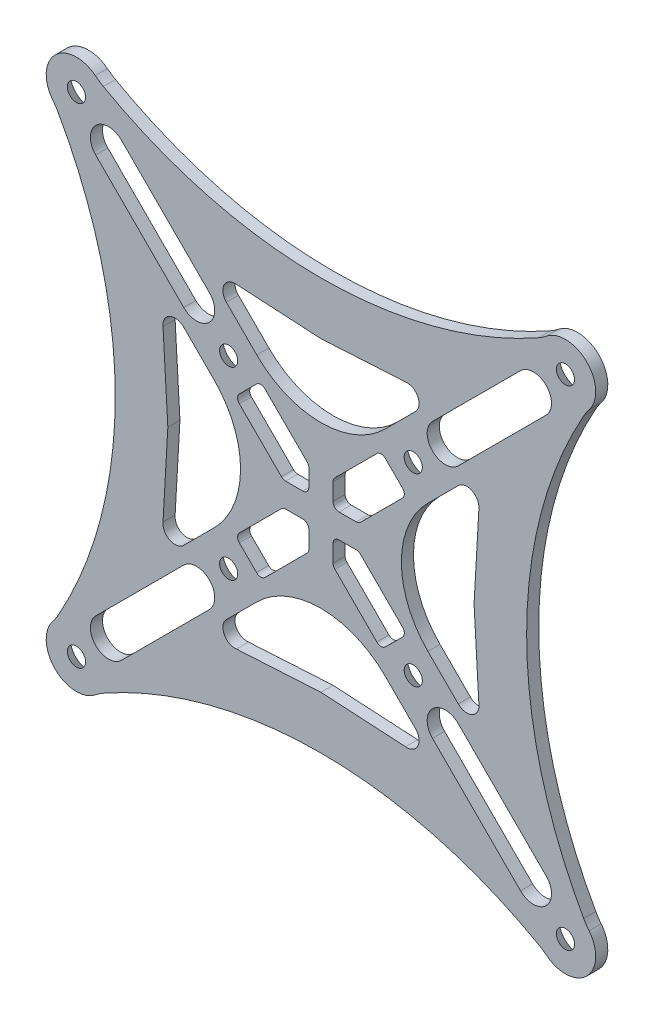
from build123d import *
from OCP.BRepFilletAPI import BRepFilletAPI_MakeChamfer

# Parameters (mm, degrees)
SKETCH_1_R       = 1.5
EXTRUDE_1_DEPTH  = 2
CHAMFER_2_SIZE   = 2
CHAMFER_2_SIZE_2 = 1.5


with BuildPart() as part:
    # 草图1 → 凸台-拉伸1 (new body)
    with BuildSketch(Plane.XY):
        with BuildLine():
            ThreePointArc((-43.944231971, -35.993777794), (-44.364829153, -36.675490513), (-44.838639776, -37.321352508))
            ThreePointArc((-44.838639776, -37.321352508), (-44.464367688, -43.973521466), (-37.812198776, -44.347794369))
            ThreePointArc((-37.812198776, -44.347794369), (-37.166337282, -43.873984202), (-36.484625127, -43.453387388))
            ThreePointArc((-36.484625127, -43.453387388), (-0.528600442, -34.027870838), (35.427423346, -43.453390808))
            ThreePointArc((35.427423346, -43.453390808), (36.109133758, -43.873986539), (36.754993697, -44.347795354))
            ThreePointArc((36.754993697, -44.347795354), (43.407161932, -43.973520907), (43.78143346, -37.321352507))
            ThreePointArc((43.78143346, -37.321352507), (43.307622836, -36.675490511), (42.887025653, -35.99377779))
            ThreePointArc((42.887025653, -35.99377779), (33.461509541, -0.037757365), (42.887025658, 35.918263059))
            ThreePointArc((42.887025658, 35.918263059), (43.307622839, 36.599975778), (43.781433461, 37.245837772))
            ThreePointArc((43.781433461, 37.245837772), (43.407160939, 43.898007163), (36.754991502, 44.272278867))
            ThreePointArc((36.754991502, 44.272278867), (36.109129005, 43.798467788), (35.42741572, 43.377870236))
            ThreePointArc((35.42741572, 43.377870236), (-0.528600445, 33.952354559), (-36.484617506, 43.37786682))
            ThreePointArc((-36.484617506, 43.37786682), (-37.166332534, 43.798465454), (-37.812196583, 44.272277884))
            ThreePointArc((-37.812196583, 44.272277884), (-44.464366696, 43.898007721), (-44.838639776, 37.245837771))
            ThreePointArc((-44.838639776, 37.245837771), (-44.364829153, 36.599975777), (-43.944231971, 35.918263057))
            ThreePointArc((-43.944231971, 35.918263057), (-34.518715856, -0.037757368), (-43.944231971, -35.993777794))
        make_face()
        with Locations((-40.928833565, 40.36247304)):
            Circle(SKETCH_1_R, mode=Mode.SUBTRACT)
        with BuildLine():
            Line((-37.74685305, -33.013366574), (-23.20322436, -18.469737884))
            ThreePointArc((-23.20322436, -18.469737884), (-18.960583673, -18.469737884), (-18.960583673, -22.712378571))
            Line((-18.960583673, -22.712378571), (-33.504212363, -37.256007261))
            ThreePointArc((-33.504212363, -37.256007261), (-37.74685305, -37.256007261), (-37.74685305, -33.013366574))
        make_face(mode=Mode.SUBTRACT)
        with BuildLine():
            Line((10.07799856, -17.715426898), (15.096806284, -22.734234622))
            ThreePointArc((15.096806284, -22.734234622), (15.4831952, -25.018982914), (13.452558365, -26.13517519))
            add(Edge.make_bspline(
                [(13.452558365, -26.13517519), (8.792171191, -25.869430733), (4.131784017, -25.603686276), (-0.528603157, -25.33794182)],
                knots=[0, 0, 0, 0, 1.400387298, 1.400387298, 1.400387298, 1.400387298], degree=3))
            add(Edge.make_bspline(
                [(-14.50976468, -26.13517519), (-9.849377505, -25.869430733), (-5.188990331, -25.603686276), (-0.528603157, -25.33794182)],
                knots=[0, 0, 0, 0, 1.400387298, 1.400387298, 1.400387298, 1.400387298], degree=3))
            ThreePointArc((-14.50976468, -26.13517519), (-16.540401515, -25.018982914), (-16.154012599, -22.734234622))
            Line((-16.154012599, -22.734234622), (-11.135204875, -17.715426898))
            ThreePointArc((-11.135204875, -17.715426898), (-0.528603157, -13.322028616), (10.07799856, -17.715426898))
        make_face(mode=Mode.SUBTRACT)
        with BuildLine():
            Line((-18.206272687, -10.644359086), (-23.225080411, -15.66316681))
            ThreePointArc((-23.225080411, -15.66316681), (-25.509828703, -16.049555726), (-26.626020979, -14.01891889))
            add(Edge.make_bspline(
                [(-26.626020979, -14.01891889), (-26.360276522, -9.358531716), (-26.094532065, -4.698144542), (-25.828787609, -0.037757368)],
                knots=[0, 0, 0, 0, 1.400387298, 1.400387298, 1.400387298, 1.400387298], degree=3))
            add(Edge.make_bspline(
                [(-26.626020979, 13.943404154), (-26.360276522, 9.28301698), (-26.094532065, 4.622629806), (-25.828787609, -0.037757368)],
                knots=[0, 0, 0, 0, 1.400387298, 1.400387298, 1.400387298, 1.400387298], degree=3))
            ThreePointArc((-26.626020979, 13.943404154), (-25.509828703, 15.974040989), (-23.225080411, 15.587652073))
            Line((-23.225080411, 15.587652073), (-18.206272687, 10.568844349))
            ThreePointArc((-18.206272687, 10.568844349), (-13.812874405, -0.037757368), (-18.206272687, -10.644359086))
        make_face(mode=Mode.SUBTRACT)
        with BuildLine():
            ThreePointArc((-9.768195517, -13.519990415), (-10.475302299, -13.812883634), (-11.18240908, -13.519990415))
            Line((-11.18240908, -13.519990415), (-14.010836204, -10.691563291))
            ThreePointArc((-14.010836204, -10.691563291), (-14.303729423, -9.984456509), (-14.010836204, -9.277349728))
            Line((-14.010836204, -9.277349728), (-7.064137063, -2.330650587))
            ThreePointArc((-7.064137063, -2.330650587), (-6.739713715, -2.113877836), (-6.357030282, -2.037757368))
            Line((-6.357030282, -2.037757368), (-3.528603157, -2.037757368))
            ThreePointArc((-3.528603157, -2.037757368), (-2.821496376, -2.330650587), (-2.528603157, -3.037757368))
            Line((-2.528603157, -3.037757368), (-2.528603157, -5.866184493))
            ThreePointArc((-2.528603157, -5.866184493), (-2.604723625, -6.248867925), (-2.821496376, -6.573291274))
            Line((-2.821496376, -6.573291274), (-9.768195517, -13.519990415))
        make_face(mode=Mode.SUBTRACT)
        with BuildLine():
            ThreePointArc((17.903377358, -22.712378571), (17.903377358, -18.469737884), (22.146018045, -18.469737884))
            Line((22.146018045, -18.469737884), (36.689646735, -33.013366574))
            ThreePointArc((36.689646735, -33.013366574), (36.689646735, -37.256007261), (32.447006048, -37.256007261))
            Line((32.447006048, -37.256007261), (17.903377358, -22.712378571))
        make_face(mode=Mode.SUBTRACT)
        with BuildLine():
            ThreePointArc((12.95362989, -9.277349728), (13.246523108, -9.984456509), (12.95362989, -10.691563291))
            Line((12.95362989, -10.691563291), (10.125202765, -13.519990415))
            ThreePointArc((10.125202765, -13.519990415), (9.418095984, -13.812883634), (8.710989202, -13.519990415))
            Line((8.710989202, -13.519990415), (1.764290061, -6.573291274))
            ThreePointArc((1.764290061, -6.573291274), (1.54751731, -6.248867925), (1.471396843, -5.866184493))
            Line((1.471396843, -5.866184493), (1.471396843, -3.037757368))
            ThreePointArc((1.471396843, -3.037757368), (1.764290061, -2.330650587), (2.471396843, -2.037757368))
            Line((2.471396843, -2.037757368), (5.299823967, -2.037757368))
            ThreePointArc((5.299823967, -2.037757368), (5.6825074, -2.113877836), (6.006930748, -2.330650587))
            Line((6.006930748, -2.330650587), (12.95362989, -9.277349728))
        make_face(mode=Mode.SUBTRACT)
        with BuildLine():
            ThreePointArc((-14.010836204, 9.201834992), (-14.303729423, 9.908941773), (-14.010836204, 10.616048554))
            Line((-14.010836204, 10.616048554), (-11.18240908, 13.444475679))
            ThreePointArc((-11.18240908, 13.444475679), (-10.475302299, 13.737368897), (-9.768195517, 13.444475679))
            Line((-9.768195517, 13.444475679), (-2.821496376, 6.497776538))
            ThreePointArc((-2.821496376, 6.497776538), (-2.604723625, 6.173353189), (-2.528603157, 5.790669756))
            Line((-2.528603157, 5.790669756), (-2.528603157, 2.962242632))
            ThreePointArc((-2.528603157, 2.962242632), (-2.821496376, 2.25513585), (-3.528603157, 1.962242632))
            Line((-3.528603157, 1.962242632), (-6.357030282, 1.962242632))
            ThreePointArc((-6.357030282, 1.962242632), (-6.739713715, 2.038363099), (-7.064137063, 2.25513585))
            Line((-7.064137063, 2.25513585), (-14.010836204, 9.201834992))
        make_face(mode=Mode.SUBTRACT)
        with BuildLine():
            ThreePointArc((13.452558365, 26.059660453), (15.4831952, 24.943468177), (15.096806284, 22.658719885))
            Line((15.096806284, 22.658719885), (10.07799856, 17.639912161))
            ThreePointArc((10.07799856, 17.639912161), (-0.528603157, 13.246513879), (-11.135204875, 17.639912161))
            Line((-11.135204875, 17.639912161), (-16.154012599, 22.658719885))
            ThreePointArc((-16.154012599, 22.658719885), (-16.540401515, 24.943468177), (-14.50976468, 26.059660453))
            add(Edge.make_bspline(
                [(-14.50976468, 26.059660453), (-9.849377505, 25.793915996), (-5.188990331, 25.52817154), (-0.528603157, 25.262427083)],
                knots=[0, 0, 0, 0, 1.400387298, 1.400387298, 1.400387298, 1.400387298], degree=3))
            add(Edge.make_bspline(
                [(13.452558365, 26.059660453), (8.792171191, 25.793915996), (4.131784017, 25.52817154), (-0.528603157, 25.262427083)],
                knots=[0, 0, 0, 0, 1.400387298, 1.400387298, 1.400387298, 1.400387298], degree=3))
        make_face(mode=Mode.SUBTRACT)
        with BuildLine():
            ThreePointArc((-37.74685305, 32.937851837), (-37.74685305, 37.180492524), (-33.504212363, 37.180492524))
            Line((-33.504212363, 37.180492524), (-18.960583673, 22.636863834))
            ThreePointArc((-18.960583673, 22.636863834), (-18.960583673, 18.394223147), (-23.20322436, 18.394223147))
            Line((-23.20322436, 18.394223147), (-37.74685305, 32.937851837))
        make_face(mode=Mode.SUBTRACT)
        with BuildLine():
            ThreePointArc((8.710989202, 13.444475679), (9.418095984, 13.737368897), (10.125202765, 13.444475679))
            Line((10.125202765, 13.444475679), (12.95362989, 10.616048554))
            ThreePointArc((12.95362989, 10.616048554), (13.246523108, 9.908941773), (12.95362989, 9.201834992))
            Line((12.95362989, 9.201834992), (6.006930748, 2.25513585))
            ThreePointArc((6.006930748, 2.25513585), (5.6825074, 2.038363099), (5.299823967, 1.962242632))
            Line((5.299823967, 1.962242632), (2.471396843, 1.962242632))
            ThreePointArc((2.471396843, 1.962242632), (1.764290061, 2.25513585), (1.471396843, 2.962242632))
            Line((1.471396843, 2.962242632), (1.471396843, 5.790669756))
            ThreePointArc((1.471396843, 5.790669756), (1.54751731, 6.173353189), (1.764290061, 6.497776538))
            Line((1.764290061, 6.497776538), (8.710989202, 13.444475679))
        make_face(mode=Mode.SUBTRACT)
        with BuildLine():
            Line((22.167874096, -15.66316681), (17.149066372, -10.644359086))
            ThreePointArc((17.149066372, -10.644359086), (12.75566809, -0.037757368), (17.149066372, 10.56884435))
            Line((17.149066372, 10.56884435), (22.167874096, 15.587652073))
            ThreePointArc((22.167874096, 15.587652073), (24.452622388, 15.974040989), (25.568814664, 13.943404154))
            add(Edge.make_bspline(
                [(25.568814664, 13.943404154), (25.303070207, 9.28301698), (25.03732575, 4.622629806), (24.771581294, -0.037757368)],
                knots=[0, 0, 0, 0, 1.400387298, 1.400387298, 1.400387298, 1.400387298], degree=3))
            add(Edge.make_bspline(
                [(25.568814664, -14.01891889), (25.303070207, -9.358531716), (25.03732575, -4.698144542), (24.771581294, -0.037757368)],
                knots=[0, 0, 0, 0, 1.400387298, 1.400387298, 1.400387298, 1.400387298], degree=3))
            ThreePointArc((25.568814664, -14.01891889), (24.452622388, -16.049555726), (22.167874096, -15.66316681))
        make_face(mode=Mode.SUBTRACT)
        with BuildLine():
            ThreePointArc((22.146018045, 18.394223147), (17.903377358, 18.394223147), (17.903377358, 22.636863834))
            Line((17.903377358, 22.636863834), (32.447006048, 37.180492524))
            ThreePointArc((32.447006048, 37.180492524), (36.689646735, 37.180492524), (36.689646735, 32.937851837))
            Line((36.689646735, 32.937851837), (22.146018045, 18.394223147))
        make_face(mode=Mode.SUBTRACT)
        with Locations((-40.928833565, -40.437987776)):
            Circle(SKETCH_1_R, mode=Mode.SUBTRACT)
        with Locations((-15.778603157, -15.287757368)):
            Circle(SKETCH_1_R, mode=Mode.SUBTRACT)
        with Locations((39.871627251, -40.437987776)):
            Circle(SKETCH_1_R, mode=Mode.SUBTRACT)
        with Locations((14.721396843, -15.287757368)):
            Circle(SKETCH_1_R, mode=Mode.SUBTRACT)
        with Locations((-15.778603157, 15.212242632)):
            Circle(SKETCH_1_R, mode=Mode.SUBTRACT)
        with Locations((39.871627251, 40.36247304)):
            Circle(SKETCH_1_R, mode=Mode.SUBTRACT)
        with Locations((14.721396843, 15.212242632)):
            Circle(SKETCH_1_R, mode=Mode.SUBTRACT)
    extrude(amount=EXTRUDE_1_DEPTH)

    # 倒角2
    chamfer_2_edges_1 = [part.edges().sort_by_distance(p)[0] for p in [
        (38.371627251, -40.437987776, 0),
    ]]
    chamfer_2_side_1 = [part.faces().sort_by_distance(p)[0] for p in [
        (38.371627251, -40.437987776, 0.03),
    ]]
    chamfer_2_edges_2 = [part.edges().sort_by_distance(p)[0] for p in [
        (13.221396843, -15.287757368, 0),
    ]]
    chamfer_2_side_2 = [part.faces().sort_by_distance(p)[0] for p in [
        (13.221396843, -15.287757368, 0.03),
    ]]
    chamfer_2_edges_3 = [part.edges().sort_by_distance(p)[0] for p in [
        (-42.428833565, -40.437987776, 0),
    ]]
    chamfer_2_side_3 = [part.faces().sort_by_distance(p)[0] for p in [
        (-42.428833565, -40.437987776, 0.03),
    ]]
    chamfer_2_edges_4 = [part.edges().sort_by_distance(p)[0] for p in [
        (-17.278603157, -15.287757368, 0),
    ]]
    chamfer_2_side_4 = [part.faces().sort_by_distance(p)[0] for p in [
        (-17.278603157, -15.287757368, 0.03),
    ]]
    chamfer_2_edges_5 = [part.edges().sort_by_distance(p)[0] for p in [
        (38.371627251, 40.36247304, 0),
    ]]
    chamfer_2_side_5 = [part.faces().sort_by_distance(p)[0] for p in [
        (38.371627251, 40.36247304, 0.03),
    ]]
    chamfer_2_edges_6 = [part.edges().sort_by_distance(p)[0] for p in [
        (-17.278603157, 15.212242632, 0),
    ]]
    chamfer_2_side_6 = [part.faces().sort_by_distance(p)[0] for p in [
        (-17.278603157, 15.212242632, 0.03),
    ]]
    chamfer_2_edges_7 = [part.edges().sort_by_distance(p)[0] for p in [
        (13.221396843, 15.212242632, 0),
    ]]
    chamfer_2_side_7 = [part.faces().sort_by_distance(p)[0] for p in [
        (13.221396843, 15.212242632, 0.03),
    ]]
    chamfer_2_edges_8 = [part.edges().sort_by_distance(p)[0] for p in [
        (-42.428833565, 40.36247304, 0),
    ]]
    chamfer_2_side_8 = [part.faces().sort_by_distance(p)[0] for p in [
        (-42.428833565, 40.36247304, 0.03),
    ]]
    chamfer_2 = BRepFilletAPI_MakeChamfer(part.part.solid().wrapped)
    for e in chamfer_2_edges_1:
        chamfer_2.Add(CHAMFER_2_SIZE - 0.0001, CHAMFER_2_SIZE_2 - 0.0001, e.wrapped, chamfer_2_side_1[0].wrapped)
    for e in chamfer_2_edges_2:
        chamfer_2.Add(CHAMFER_2_SIZE - 0.0001, CHAMFER_2_SIZE_2 - 0.0001, e.wrapped, chamfer_2_side_2[0].wrapped)
    for e in chamfer_2_edges_3:
        chamfer_2.Add(CHAMFER_2_SIZE - 0.0001, CHAMFER_2_SIZE_2 - 0.0001, e.wrapped, chamfer_2_side_3[0].wrapped)
    for e in chamfer_2_edges_4:
        chamfer_2.Add(CHAMFER_2_SIZE - 0.0001, CHAMFER_2_SIZE_2 - 0.0001, e.wrapped, chamfer_2_side_4[0].wrapped)
    for e in chamfer_2_edges_5:
        chamfer_2.Add(CHAMFER_2_SIZE - 0.0001, CHAMFER_2_SIZE_2 - 0.0001, e.wrapped, chamfer_2_side_5[0].wrapped)
    for e in chamfer_2_edges_6:
        chamfer_2.Add(CHAMFER_2_SIZE - 0.0001, CHAMFER_2_SIZE_2 - 0.0001, e.wrapped, chamfer_2_side_6[0].wrapped)
    for e in chamfer_2_edges_7:
        chamfer_2.Add(CHAMFER_2_SIZE - 0.0001, CHAMFER_2_SIZE_2 - 0.0001, e.wrapped, chamfer_2_side_7[0].wrapped)
    for e in chamfer_2_edges_8:
        chamfer_2.Add(CHAMFER_2_SIZE - 0.0001, CHAMFER_2_SIZE_2 - 0.0001, e.wrapped, chamfer_2_side_8[0].wrapped)
    add(Compound.cast(chamfer_2.Shape()), mode=Mode.REPLACE)  # a hair under: the kernel refuses the full size


solid = part.part
